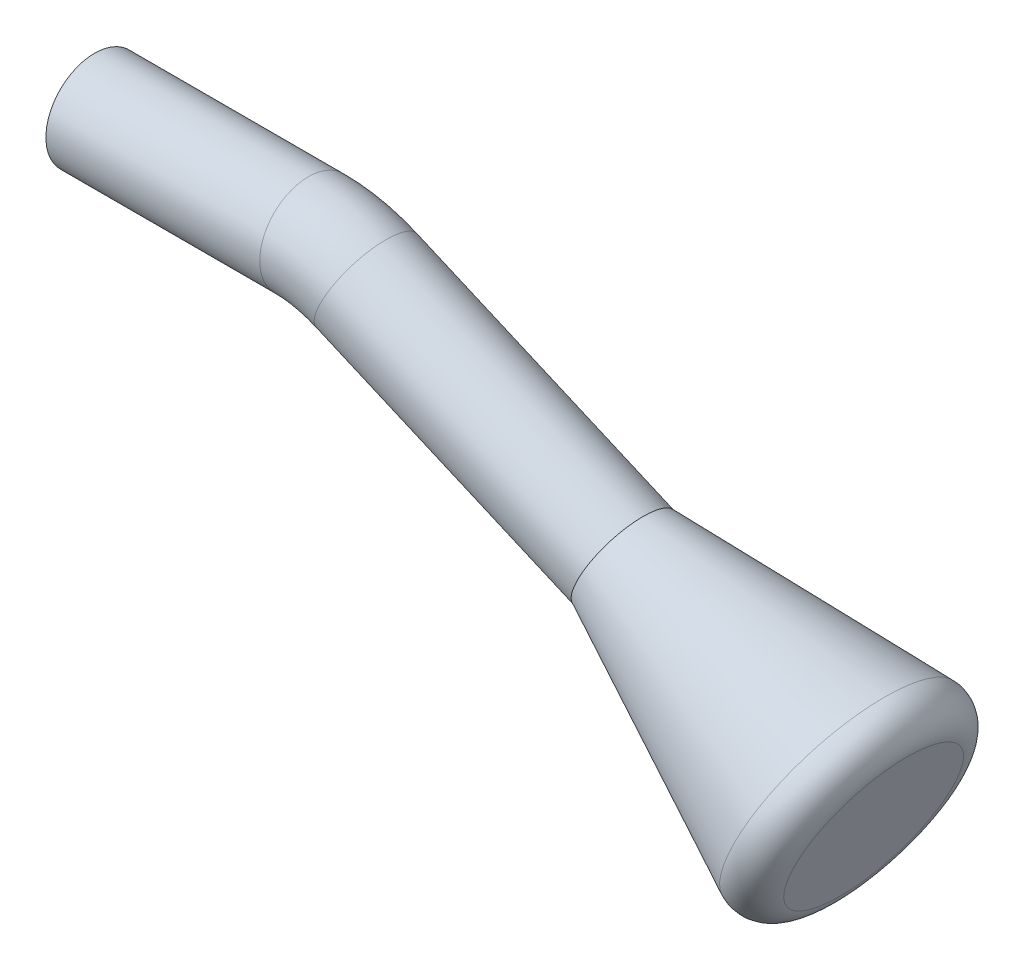
from build123d import *

# Parameters (mm, degrees)
SKETCH_2_R      = 5
SKETCH_3_R      = 12.5
EXTRUDE_1_DEPTH = 30
EXTRUDE_1_DRAFT = -15
FILLET_2_R      = 3


with BuildPart() as part:
    # По траектории1: sweep along a path in Эскиз1
    with BuildLine(Plane.XY) as sweep_1_path:
        Line((0, 0), (21.958559609, 0))
        ThreePointArc((21.958559609, 0), (25, -0.311581421), (27.915086215, -1.233381287))
        Line((27.915086215, -1.233381287), (80, -23.7694289))
    # Эскиз2 → По траектории1 (sweep)
    with BuildSketch(Plane(origin=(0, 0, 0), x_dir=(0, 0, -1), z_dir=(1, 0, 0))):
        Circle(SKETCH_2_R)
    sweep(path=sweep_1_path.line)


with BuildPart() as extrude_1_tool:
    # Эскиз3 → Бобышка-Вытянуть1 (with draft: the straight prism first)
    with BuildSketch(Plane(origin=(76.047580818, -32.904190055, 0), x_dir=(0, 0, -1), z_dir=(0.9177745808471026, -0.3971017737947355, 0))):
        with Locations((0, 9.953164258)):
            Circle(SKETCH_3_R)
    extrude(amount=-EXTRUDE_1_DEPTH)
    # Бобышка-Вытянуть1: the draft: its side faces are tilted about the plane it starts from
    extrude_1_sides = [extrude_1_tool.faces().sort_by_distance(p)[0] for p in [
        (66.233381287, -17.812902293, 12.5),
    ]]
    draft(extrude_1_sides, Plane(origin=(76.047580818, -32.904190055, 0), x_dir=(0, 0, -1), z_dir=(0.9177745808471026, -0.3971017737947355, 0)), EXTRUDE_1_DRAFT)


with BuildPart() as part_1:
    add(part.part)

    # Бобышка-Вытянуть1: add extrude_1_tool
    add(extrude_1_tool.part)

    # Скругление2
    fillet_2_edges = [part_1.edges().sort_by_distance(p)[0] for p in [
        (80, -23.7694289, 12.5),
    ]]
    fillet(fillet_2_edges, radius=FILLET_2_R)


solid = part_1.part
